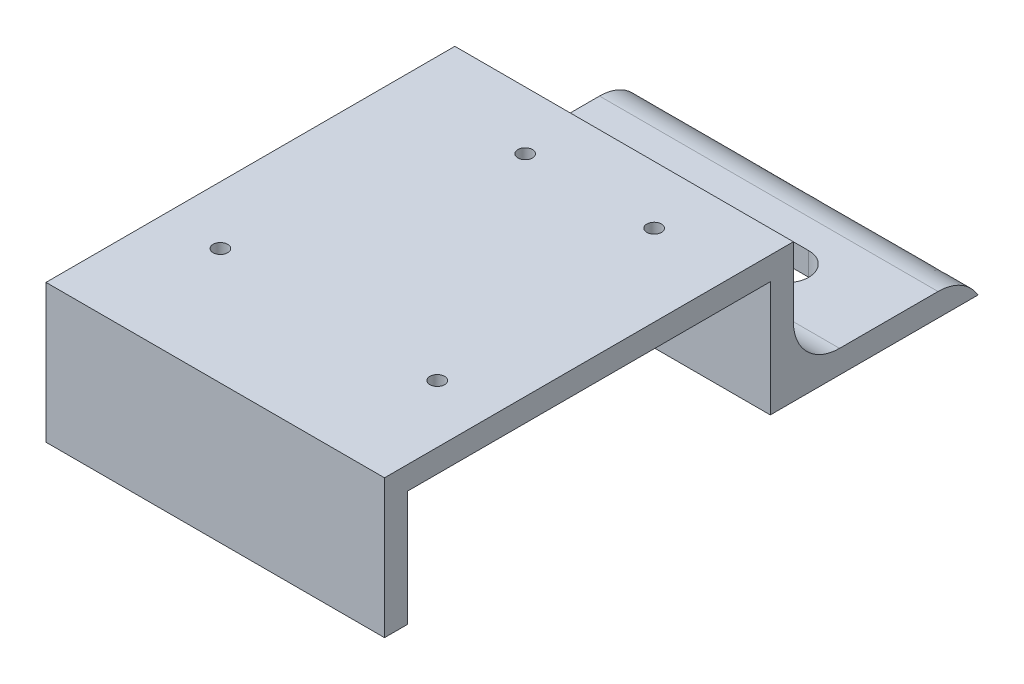
from build123d import *

# Parameters (mm, degrees)
SKETCH2_W           = 73.34
SKETCH2_H           = 88.58
BOSS_EXTRUDE1_DEPTH = 5
SKETCH1_R           = 1.5875
CUT_EXTRUDE3_DEPTH  = 50
SKETCH3_W           = 73.34
SKETCH3_H           = 5
BOSS_EXTRUDE2_DEPTH = 25
SKETCH4_W           = 73.34
SKETCH4_H           = 5
BOSS_EXTRUDE3_DEPTH = 40
CUT_EXTRUDE4_DEPTH  = 40
VARFILLET1_START    = -64
VARFILLET1_DEPTH    = 75
VARFILLET2_START    = -63.34
VARFILLET2_DEPTH    = 73.34


with BuildPart() as part:
    # Sketch2 → Boss-Extrude1 (new body)
    with BuildSketch(Plane(origin=(0, 0, 0), x_dir=(1, 0, 0), z_dir=(0, 1, 0))):
        with Locations((-26.67, 34.29)):
            Rectangle(SKETCH2_W, SKETCH2_H)
    extrude(amount=BOSS_EXTRUDE1_DEPTH)

    # Sketch1 → Cut-Extrude3 (cut)
    with BuildSketch(Plane(origin=(0, 0, 0), x_dir=(1, 0, 0), z_dir=(0, 1, 0))):
        with Locations(Location((-7.62, 66.04, 0), (0, 0, 90))):
            Circle(SKETCH1_R)
        with Locations(Location((-35.56, 66.04, 0), (0, 0, 90))):
            Circle(SKETCH1_R)
        with Locations(Location((-2.54, 13.97, 0), (0, 0, 90))):
            Circle(SKETCH1_R)
        with Locations(Location((-50.8, 15.24, 0), (0, 0, 90))):
            Circle(SKETCH1_R)
    extrude(amount=CUT_EXTRUDE3_DEPTH, mode=Mode.SUBTRACT)

    # Sketch3 → Boss-Extrude2 (add)
    with BuildSketch(Plane.XZ):
        with Locations((-26.67, -76.08)):
            Rectangle(SKETCH3_W, SKETCH3_H)
        with Locations((-26.67, 7.5)):
            Rectangle(SKETCH3_W, SKETCH3_H)
    extrude(amount=BOSS_EXTRUDE2_DEPTH)

    # Sketch4 → Boss-Extrude3 (add)
    with BuildSketch(Plane(origin=(0, 0, -78.58), x_dir=(-1, 0, 0), z_dir=(0, 0, -1))):
        with Locations((26.67, -22.5)):
            Rectangle(SKETCH4_W, SKETCH4_H)
    extrude(amount=BOSS_EXTRUDE3_DEPTH)

    # Sketch5 → Cut-Extrude4 (cut)
    with BuildSketch(Plane(origin=(0, -20, 0), x_dir=(1, 0, 0), z_dir=(0, 1, 0))):
        with BuildLine():
            Line((-41.67, 93.58), (-11.67, 93.58))
            ThreePointArc((-11.67, 93.58), (-6.67, 98.58), (-11.67, 103.58))
            Line((-11.67, 103.58), (-41.67, 103.58))
            ThreePointArc((-41.67, 103.58), (-46.67, 98.58), (-41.67, 93.58))
        make_face()
    extrude(amount=-CUT_EXTRUDE4_DEPTH, mode=Mode.SUBTRACT)

    # VarFillet1: read off the stored shape, not the designer's step
    # VarFillet1 outline → VarFillet1 (cut)
    with BuildSketch(Plane.YZ.offset(VARFILLET1_START)):
        with BuildLine():
            add(Edge.make_bspline(
                [(-25, -118.58), (-20, -115.693248654), (-20, -109.919745962)],
                knots=[0, 0, 0, 1, 1, 1], degree=2, weights=[1, 0.866025404, 1]))
            Line((-25, -118.58), (-20, -118.58))
            Line((-20, -118.58), (-20, -109.919745962))
        make_face()
    extrude(amount=VARFILLET1_DEPTH, mode=Mode.SUBTRACT)

    # VarFillet2: read off the stored shape, not the designer's step
    # VarFillet2 outline → VarFillet2 (add)
    with BuildSketch(Plane.YZ.offset(VARFILLET2_START)):
        with BuildLine():
            Line((-20, -78.58), (-20, -88.58))
            add(Edge.make_bspline(
                [(-20, -88.58), (-20, -78.58), (-10, -78.58)],
                knots=[0, 0, 0, 1, 1, 1], degree=2, weights=[1, 0.707106781, 1]))
            Line((-10, -78.58), (-20, -78.58))
        make_face()
    extrude(amount=VARFILLET2_DEPTH)


solid = part.part
